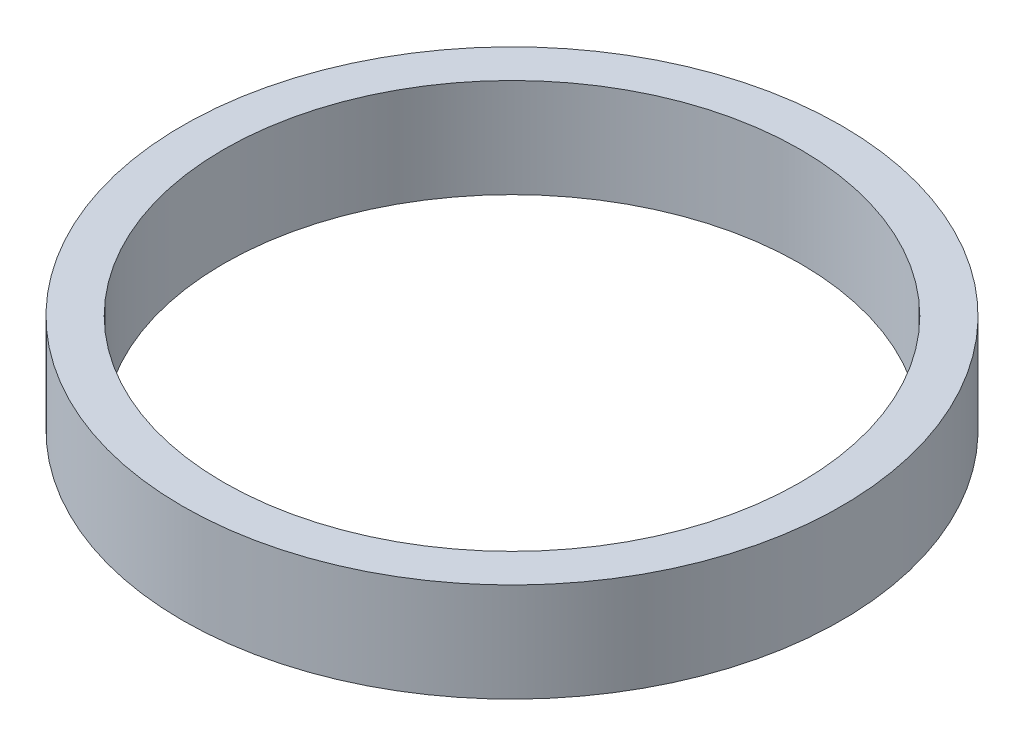
from build123d import *

# Parameters (mm, degrees)
SKETCH_1_R      = 10
SKETCH_1_R_2    = 8.75
EXTRUDE_1_DEPTH = 3


with BuildPart() as part:
    # Эскиз1 → Бобышка-Вытянуть1 (new body)
    with BuildSketch(Plane(origin=(0, 0, 0), x_dir=(1, 0, 0), z_dir=(0, 1, 0))):
        Circle(SKETCH_1_R)
        Circle(SKETCH_1_R_2, mode=Mode.SUBTRACT)
    extrude(amount=EXTRUDE_1_DEPTH)


solid = part.part
